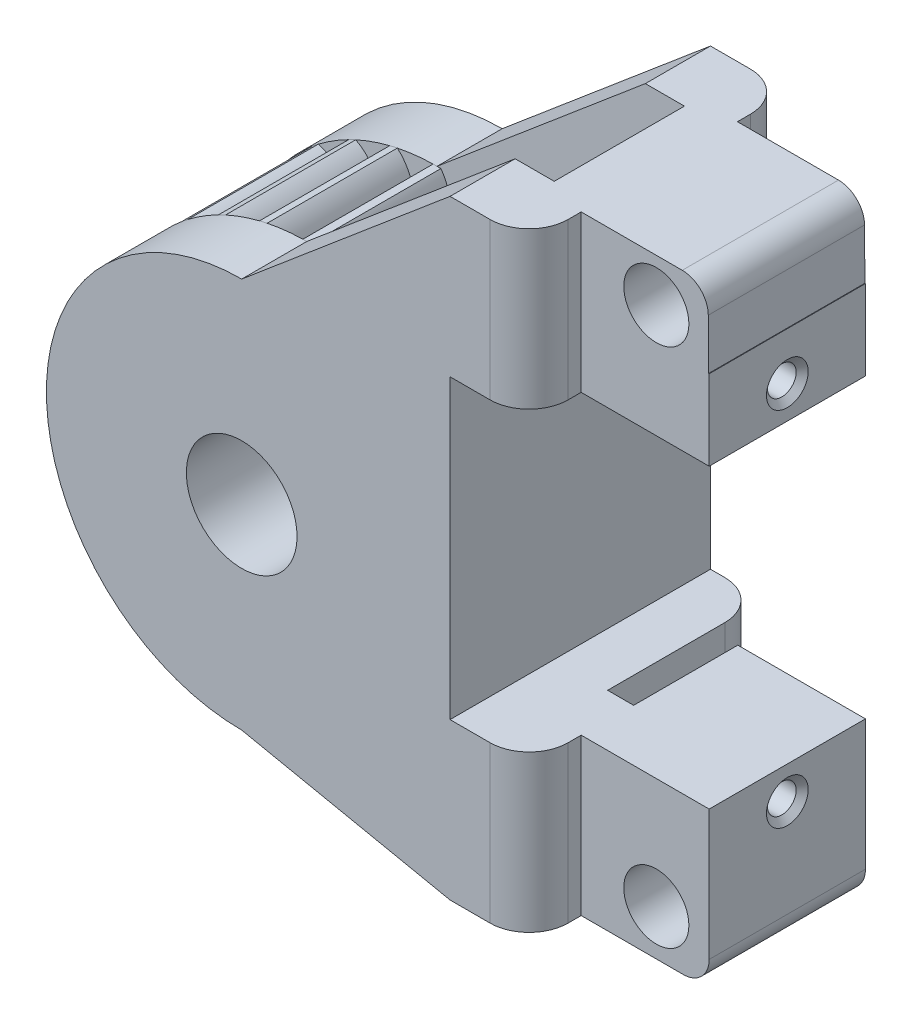
from build123d import *
from OCP.BRepFilletAPI import BRepFilletAPI_MakeChamfer
from build123d.topology import SkipClean

# Parameters (mm, degrees)
SKETCH2_R                = 13
SKETCH2_R_2              = 4.25
BOSS_EXTRUDE1_DEPTH      = 10
BOSS_EXTRUDE2_DEPTH      = 10
CIRPATTERN1_COUNT        = 28
SKETCH3_R                = 15
SKETCH3_R_2              = 7.5
BOSS_EXTRUDE3_DEPTH      = 5
SKETCH5_R                = 7.5
SKETCH5_R_2              = 4.25
BOSS_EXTRUDE4_DEPTH      = 5
SKETCH6_W                = 6
SKETCH6_H                = 6.15
SKETCH6_H_2              = 6.05
BOSS_EXTRUDE7_DEPTH      = 10
BOSS_EXTRUDE8_DEPTH      = 5
SKETCH17_R               = 7.5
SKETCH17_R_2             = 4.25
BOSS_EXTRUDE10_DEPTH     = 5
SKETCH22_W               = 15.9
SKETCH22_H               = 12.000273223
BOSS_EXTRUDE11_DEPTH     = 20
BOSS_EXTRUDE12_DEPTH     = 5
BOSS_EXTRUDE13_DEPTH     = 5
CHAMFER2_DEPTH           = 10
CHAMFER3_SIZE            = 5
CHAMFER3_SIZE_2          = 9.134026168
SKETCH18_R               = 1.1
CUT_EXTRUDE7_DEPTH       = 5
SKETCH20_W               = 2
SKETCH20_H               = 12.969905756
CUT_EXTRUDE10_DEPTH      = 12
CUT_EXTRUDE11_DEPTH      = 48.221393457
CUT_EXTRUDE11_DEPTH_BACK = 48.221393457
SKETCH21_R               = 2.5
CHAMFER1_SIZE            = 0.5
FILLET1_R                = 2
CHAMFER5_SIZE            = 3
CHAMFER5_SIZE_2          = 11.196152423
CHAMFER6_SIZE            = 6.541705237
CHAMFER6_SIZE_2          = 2
CHAMFER7_SIZE            = 0.5
CHAMFER7_SIZE2           = 0.419549816
CUT_EXTRUDE13_DEPTH      = 4
FILLET6_R                = 3


with BuildPart() as part:
    # Sketch2 → Boss-Extrude1 (new body)
    with BuildSketch(Plane.XY):
        Circle(SKETCH2_R)
        Circle(SKETCH2_R_2, mode=Mode.SUBTRACT)
    extrude(amount=BOSS_EXTRUDE1_DEPTH)

    # Sketch2<3> → Boss-Extrude2 (add)
    with BuildSketch(Plane.XY):
        with BuildLine():
            ThreePointArc((1, 12.961481397), (0.8, 14.03224869), (0.3, 15))
            Line((0.3, 15), (-0.3, 15))
            ThreePointArc((-0.3, 15), (-0.8, 14.03224869), (-1, 12.961481397))
            ThreePointArc((-1, 12.961481397), (0, 13), (1, 12.961481397))
        make_face()
    boss_extrude2 = extrude(amount=BOSS_EXTRUDE2_DEPTH)

    # CirPattern1: Boss-Extrude2 ×28 about axis
    cirpattern1_axis = Axis((0, 0, 0), (0, 0, 1))
    for i in range(1, CIRPATTERN1_COUNT):
        add(boss_extrude2.rotate(cirpattern1_axis, i * 360 / CIRPATTERN1_COUNT))

    # Sketch3 → Boss-Extrude3 (add)
    with BuildSketch(Plane.XY.offset(10)):
        Circle(SKETCH3_R)
        Circle(SKETCH3_R_2, mode=Mode.SUBTRACT)
    boss_extrude3 = extrude(amount=BOSS_EXTRUDE3_DEPTH)

    # Sketch5 → Boss-Extrude4 (add)
    with BuildSketch(Plane.XY.offset(10)):
        Circle(SKETCH5_R)
        Circle(SKETCH5_R_2, mode=Mode.SUBTRACT)
    extrude(amount=BOSS_EXTRUDE4_DEPTH)

    # Sketch6 → Boss-Extrude7 (add)
    with BuildSketch(Plane.XY):
        with Locations((28.9, 19.575)):
            Rectangle(SKETCH6_W, SKETCH6_H)
        with Locations((28.9, -9.325)):
            Rectangle(SKETCH6_W, SKETCH6_H_2)
        with BuildLine():
            Line((25.9, -12.35), (25.9, -6.3))
            Line((25.9, -6.3), (16, -6.3))
            Line((16, -6.3), (13.612861565, -6.3))
            ThreePointArc((13.612861565, -6.3), (12.877389852, -7.692387835), (12, -9))
            Line((12, -9), (12, -13.81221778))
            Line((12, -13.81221778), (25.9, -12.35))
        make_face()
        with BuildLine():
            Line((16, 16.5), (25.9, 16.5))
            Line((25.9, 16.5), (25.9, 22.65))
            ThreePointArc((25.9, 22.65), (18.882932157, 21.564142143), (12, 19.819558151))
            Line((12, 19.819558151), (12, 9))
            ThreePointArc((12, 9), (14.917344582, 1.572523643), (13.612861565, -6.3))
            Line((13.612861565, -6.3), (16, -6.3))
            Line((16, -6.3), (16, 16.5))
        make_face()
        with BuildLine():
            ThreePointArc((12, -9), (12.877389852, -7.692387835), (13.612861565, -6.3))
            ThreePointArc((13.612861565, -6.3), (14.917344582, 1.572523643), (12, 9))
            Line((12, 9), (12, -9))
        make_face()
    extrude(amount=BOSS_EXTRUDE7_DEPTH)

    # Mirror1: Boss-Extrude3 across plane
    add(boss_extrude3.mirror(Plane(origin=(0, 0, 5), x_dir=(1, 0, 0), z_dir=(0, 0, -1))))

    # Sketch16 → Boss-Extrude8 (add)
    with BuildSketch(Plane.XY.offset(10)):
        with BuildLine():
            Line((25.9, 22.65), (31.9, 22.65))
            Line((31.9, 22.65), (31.9, 16.5))
            Line((31.9, 16.5), (16, 16.5))
            Line((16, 16.5), (16, -6.3))
            Line((16, -6.3), (31.9, -6.3))
            Line((31.9, -6.3), (31.9, -12.35))
            Line((31.9, -12.35), (25.9, -12.35))
            Line((25.9, -12.35), (12, -13.81221778))
            Line((12, -13.81221778), (0, -15))
            Line((0, -15), (0, -4.25))
            ThreePointArc((0, -4.25), (4.25, 0), (0, 4.25))
            Line((0, 4.25), (0, 15))
            ThreePointArc((0, 15), (12.602835008, 20.000369059), (25.9, 22.65))
        make_face()
    boss_extrude8 = extrude(amount=BOSS_EXTRUDE8_DEPTH)

    # Mirror2: Boss-Extrude8 across plane
    with SkipClean():  # the faces are left unmerged after this step: merging them gives an invalid solid
        add(boss_extrude8.mirror(Plane(origin=(0, 0, 5), x_dir=(1, 0, 0), z_dir=(0, 0, -1))))

    # Sketch17 → Boss-Extrude10 (add)
    with SkipClean():  # the faces are left unmerged after this step: merging them gives an invalid solid
        with BuildSketch(Plane(origin=(0, 0, 0), x_dir=(-1, 0, 0), z_dir=(0, 0, -1))):
            Circle(SKETCH17_R)
            with Locations(Location((0, 0, 0), (0, 0, 180))):
                Circle(SKETCH17_R_2, mode=Mode.SUBTRACT)
        extrude(amount=BOSS_EXTRUDE10_DEPTH)

    # Sketch22 → Boss-Extrude11 (add)
    with SkipClean():  # the faces are left unmerged after this step: merging them gives an invalid solid
        with BuildSketch(Plane.XY.offset(15)):
            Polygon((16, 16.5), (16, 28.5), (31.819022133, 28.5), (31.9, 16.5), align=None)
            with Locations((23.95, -12.300136612)):
                Rectangle(SKETCH22_W, SKETCH22_H)
        extrude(amount=-BOSS_EXTRUDE11_DEPTH)

    # Sketch23 → Boss-Extrude12 (add)
    with SkipClean():  # the faces are left unmerged after this step: merging them gives an invalid solid
        with BuildSketch(Plane.XY.offset(15)):
            Polygon((0, 15), (16, 28.5), (17.694516674, 17.614069166), align=None)
            Polygon((0, -15), (16, -18.300273223), (17.694516674, -11.130967412), align=None)
        extrude(amount=-BOSS_EXTRUDE12_DEPTH)

    # Sketch24 → Boss-Extrude13 (add)
    with SkipClean():  # the faces are left unmerged after this step: merging them gives an invalid solid
        with BuildSketch(Plane(origin=(0, 0, -5), x_dir=(-1, 0, 0), z_dir=(0, 0, -1))):
            Polygon((-16, 28.5), (0, 15), (-13.178111581, 17.519977393), (-20.238210425, 23.476935792), align=None)
            Polygon((-16, -18.300273223), (-18.119105213, -11.460288617), (0, -15), align=None)
        extrude(amount=-BOSS_EXTRUDE13_DEPTH)

    # Chamfer2: read off the stored shape, not the designer's step
    # Chamfer2 outline → Chamfer2 (cut)
    with SkipClean():  # the faces are left unmerged after this step: merging them gives an invalid solid
        with BuildSketch(Plane.XY):
            with BuildLine():
                Line((16, 17.11496829), (16, 20.917705029))
                ThreePointArc((16, 20.917705029), (13.992406688, 20.39629023), (12, 19.819558151))
                Line((12, 19.819558151), (12, 7.971573342))
                Line((12, 7.971573342), (16, 17.11496829))
            make_face()
        extrude(amount=CHAMFER2_DEPTH, mode=Mode.SUBTRACT)

    # Chamfer3
    # the kernel refuses this chamfer: 9.134026168, 5 mm, written as the material it takes off along each edge
    with BuildSketch(Plane(origin=(12, -13.81221778, 0), x_dir=(0.9945124534167619, 0.1046182584397819, 0), z_dir=(0, 0, 1))) as chamfer3_piece_1_section:
        Polygon((CHAMFER3_SIZE, 0), (CHAMFER3_SIZE_2 * 0.104618258445, CHAMFER3_SIZE_2 * 0.994512453469), (0, 0), align=None)
    chamfer3_piece_1 = extrude(amount=10, mode=Mode.PRIVATE)
    chamfer3_piece_1 = split(chamfer3_piece_1, bisect_by=Plane(origin=(16, -13.81221778, 0), z_dir=(-1, 0, 0)), keep=Keep.TOP, mode=Mode.PRIVATE)
    chamfer3_piece_1 = chamfer3_piece_1 - Plane(origin=(12.735999812, -3.094422282, 0), x_dir=(-0.39884925032607477, -0.9170165077654426, 0), z_dir=(0, 0, -1)) * Cylinder(3.740742473, 57, mode=Mode.PRIVATE)
    add(chamfer3_piece_1, mode=Mode.SUBTRACT)

    # Sketch18 → Cut-Extrude7 (cut)
    with BuildSketch(Plane(origin=(31.9, 0, 0), x_dir=(0, 0, -1), z_dir=(1, 0, 0))):
        with Locations((-5, 19)):
            Circle(SKETCH18_R)
        with Locations((-5, -8.8)):
            Circle(SKETCH18_R)
    extrude(amount=-CUT_EXTRUDE7_DEPTH, mode=Mode.SUBTRACT)

    # Sketch20 → Cut-Extrude10 (cut)
    with BuildSketch(Plane(origin=(0, 0, -5), x_dir=(-1, 0, 0), z_dir=(0, 0, -1))):
        with Locations((-21.1, -12.784952878)):
            Rectangle(SKETCH20_W, SKETCH20_H)
    extrude(amount=-CUT_EXTRUDE10_DEPTH, mode=Mode.SUBTRACT)

    # Sketch21 → Cut-Extrude11 (cut, two sides: drawn at the far end of the back side and taken through both)
    with BuildSketch(Plane(origin=(0, 0, -5), x_dir=(-1, 0, 0), z_dir=(0, 0, -1)).offset(-CUT_EXTRUDE11_DEPTH_BACK)):
        with Locations((-27.841281947, 25.18785233)):
            Circle(SKETCH21_R)
        with Locations((-27.841281947, -14.81214767)):
            Circle(SKETCH21_R)
    extrude(amount=CUT_EXTRUDE11_DEPTH + CUT_EXTRUDE11_DEPTH_BACK, mode=Mode.SUBTRACT)

    # Chamfer1
    chamfer1_edges = [part.edges().sort_by_distance(p)[0] for p in [
        (30.341281947, 25.18785233, -5),
        (30.341281947, 25.18785233, 15),
        (30.341281947, -14.81214767, -5),
        (30.341281947, -14.81214767, 15),
    ]]
    chamfer(chamfer1_edges, length=CHAMFER1_SIZE)

    # Fillet1
    fillet1_edges = [part.edges().sort_by_distance(p)[0] for p in [
        (31.819022133, 28.5, 5),
        (31.9, -18.300273223, 5),
    ]]
    fillet(fillet1_edges, radius=FILLET1_R)

    # Chamfer5
    # the kernel refuses this chamfer: 11.196152423, 3 mm, written as the material it takes off along each edge
    with BuildSketch(Plane(origin=(16, 28.5, 10), x_dir=(1, 0, 0), z_dir=(0, 0, -1))) as chamfer5_piece_1:
        Polygon((CHAMFER5_SIZE, 0), (0, CHAMFER5_SIZE_2), (0, 0), align=None)
    extrude(amount=10, mode=Mode.SUBTRACT)

    # Chamfer6
    # the kernel refuses this chamfer: 6.541705237, 2 mm, written as the material it takes off along each edge
    with BuildSketch(Plane(origin=(16, -18.300273223, 10), x_dir=(0, 1, 0), z_dir=(0, 0, -1))) as chamfer6_piece_1:
        Polygon((CHAMFER6_SIZE, 0), (0, CHAMFER6_SIZE_2), (0, 0), align=None)
    extrude(amount=10, mode=Mode.SUBTRACT)

    # Chamfer7: one chamfer whose edges measure the first distance from different faces: ONE call of the kernel's chamfer builder (chamfer() names one face for all edges)
    chamfer7_edges_1 = [part.edges().sort_by_distance(p)[0] for p in [
        (31.9, 19, 6.1),
    ]]
    chamfer7_side_1 = [part.faces().sort_by_distance(p)[0] for p in [
        (31.9, 22.440757915, 5),
    ]]
    chamfer7_edges_2 = [part.edges().sort_by_distance(p)[0] for p in [
        (31.9, -8.8, 6.1),
    ]]
    chamfer7_side_2 = [part.faces().sort_by_distance(p)[0] for p in [
        (31.9, -11.348575126, 5),
    ]]
    chamfer7 = BRepFilletAPI_MakeChamfer(part.part.solid().wrapped)
    for e in chamfer7_edges_1:
        chamfer7.Add(CHAMFER7_SIZE, CHAMFER7_SIZE2, e.wrapped, chamfer7_side_1[0].wrapped)  # the first distance lies on this face
    for e in chamfer7_edges_2:
        chamfer7.Add(CHAMFER7_SIZE, CHAMFER7_SIZE2, e.wrapped, chamfer7_side_2[0].wrapped)  # the first distance lies on this face
    add(Compound.cast(chamfer7.Shape()), mode=Mode.REPLACE)

    # Sketch25 → Cut-Extrude13 (cut)
    with BuildSketch(Plane(origin=(0, 0, -5), x_dir=(-1, 0, 0), z_dir=(0, 0, -1))):
        Polygon((-22.069784107, -19.07834547), (-22.069784107, 29.56210031), (-36.042412361, 30.316458488), (-36.042412361, -20.869465893), align=None)
    cut_extrude13 = extrude(amount=-CUT_EXTRUDE13_DEPTH, mode=Mode.SUBTRACT)

    # Mirror6: Cut-Extrude13 across plane
    add(cut_extrude13.mirror(Plane.XY.offset(5)), mode=Mode.SUBTRACT)

    # Fillet6
    fillet6_edges = [part.edges().sort_by_distance(p)[0] for p in [
        (20.1, -12.300136611, -5),
        (22.069784107, 22.5, -5),
        (22.069784107, -12.300136611, 15),
        (22.069784107, 22.5, 15),
    ]]
    fillet(fillet6_edges, radius=FILLET6_R)


solid = part.part
